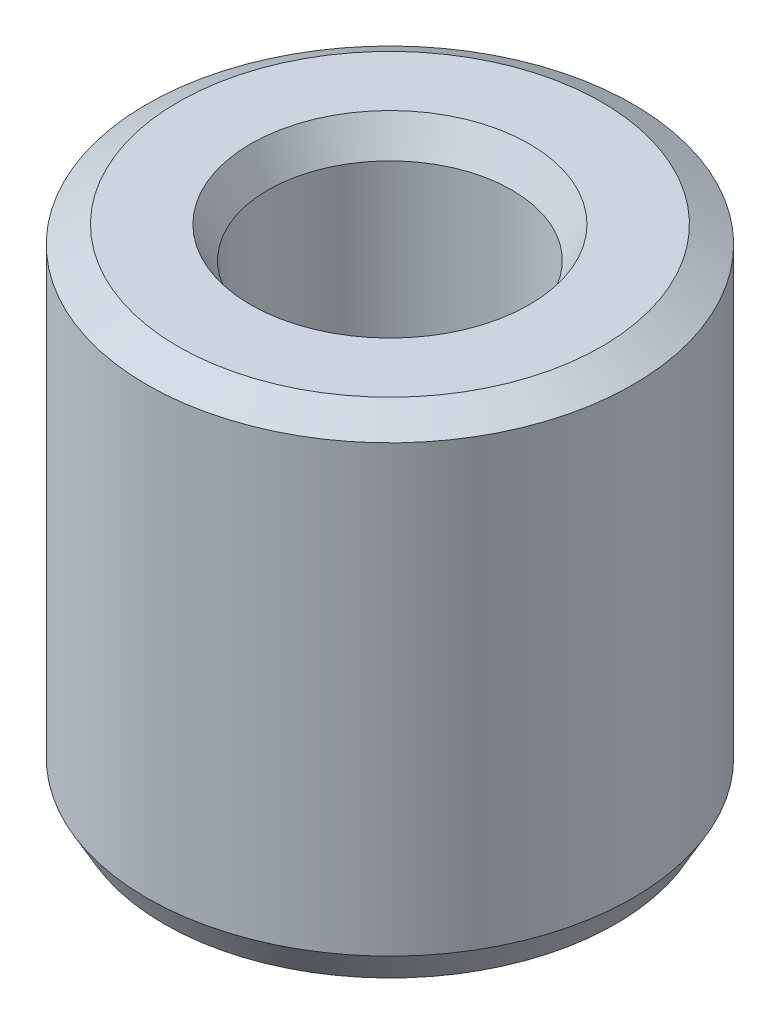
from build123d import *
from OCP.BRepFilletAPI import BRepFilletAPI_MakeChamfer

# Parameters (mm, degrees)
SKETCH1_R           = 50
BOSS_EXTRUDE1_DEPTH = 101.469136187
SKETCH2_R           = 25.084547978
CUT_EXTRUDE1_DEPTH  = 124.676940447
CHAMFER1_SIZE       = 3.587750145
CHAMFER1_SIZE2      = 6.429219517


with BuildPart() as part:
    # Sketch1 → Boss-Extrude1 (new body)
    with BuildSketch(Plane(origin=(0, 0, 0), x_dir=(1, 0, 0), z_dir=(0, 1, 0))):
        Circle(SKETCH1_R)
    extrude(amount=BOSS_EXTRUDE1_DEPTH)

    # Sketch2 → Cut-Extrude1 (cut, through all)
    with BuildSketch(Plane(origin=(0, 0, 0), x_dir=(1, 0, 0), z_dir=(0, 1, 0))):
        Circle(SKETCH2_R)
    extrude(amount=CUT_EXTRUDE1_DEPTH, mode=Mode.SUBTRACT)

    # Chamfer1: one chamfer whose edges measure the first distance from different faces: ONE call of the kernel's chamfer builder (chamfer() names one face for all edges)
    chamfer1_edges_1 = [part.edges().sort_by_distance(p)[0] for p in [
        (-25.084547978, 101.469136187, 0),
    ]]
    chamfer1_side_1 = [part.faces().sort_by_distance(p)[0] for p in [
        (-48.585786438, 101.469136187, 0),
    ]]
    chamfer1_edges_2 = [part.edges().sort_by_distance(p)[0] for p in [
        (-25.084547978, 0, 0),
    ]]
    chamfer1_side_2 = [part.faces().sort_by_distance(p)[0] for p in [
        (-25.084547978, 50.734568093, 0),
    ]]
    chamfer1_edges_3 = [part.edges().sort_by_distance(p)[0] for p in [
        (-50, 0, 0),
    ]]
    chamfer1_side_3 = [part.faces().sort_by_distance(p)[0] for p in [
        (-48.585786438, 0, 0),
    ]]
    chamfer1_edges_4 = [part.edges().sort_by_distance(p)[0] for p in [
        (-50, 101.469136187, 0),
    ]]
    chamfer1_side_4 = [part.faces().sort_by_distance(p)[0] for p in [
        (-50, 50.734568093, 0),
    ]]
    chamfer1 = BRepFilletAPI_MakeChamfer(part.part.solid().wrapped)
    for e in chamfer1_edges_1:
        chamfer1.Add(CHAMFER1_SIZE, CHAMFER1_SIZE2, e.wrapped, chamfer1_side_1[0].wrapped)  # the first distance lies on this face
    for e in chamfer1_edges_2:
        chamfer1.Add(CHAMFER1_SIZE, CHAMFER1_SIZE2, e.wrapped, chamfer1_side_2[0].wrapped)  # the first distance lies on this face
    for e in chamfer1_edges_3:
        chamfer1.Add(CHAMFER1_SIZE, CHAMFER1_SIZE2, e.wrapped, chamfer1_side_3[0].wrapped)  # the first distance lies on this face
    for e in chamfer1_edges_4:
        chamfer1.Add(CHAMFER1_SIZE, CHAMFER1_SIZE2, e.wrapped, chamfer1_side_4[0].wrapped)  # the first distance lies on this face
    add(Compound.cast(chamfer1.Shape()), mode=Mode.REPLACE)


solid = part.part
